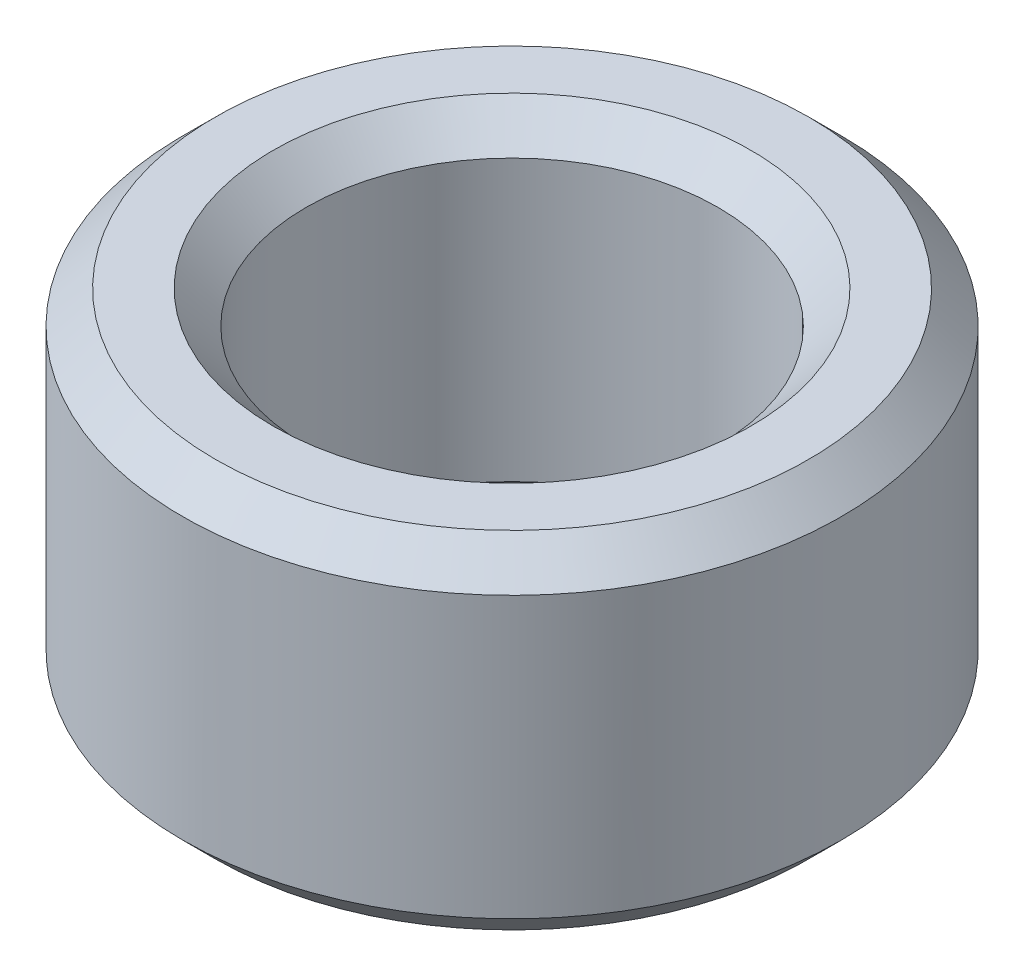
from build123d import *

# Parameters (mm, degrees)
SKETCH1_R           = 2
SKETCH1_R_2         = 1.25
BOSS_EXTRUDE1_DEPTH = 2.1
CHAMFER1_SIZE       = 0.2


with BuildPart() as part:
    # Sketch1 → Boss-Extrude1 (new body)
    with BuildSketch(Plane(origin=(0, 0, 0), x_dir=(1, 0, 0), z_dir=(0, 1, 0))):
        Circle(SKETCH1_R)
        Circle(SKETCH1_R_2, mode=Mode.SUBTRACT)
    extrude(amount=BOSS_EXTRUDE1_DEPTH)

    # Chamfer1
    chamfer1_edges = [part.edges().sort_by_distance(p)[0] for p in [
        (-1.25, 0, 0),
        (-1.25, 2.1, 0),
        (-2, 0, 0),
        (-2, 2.1, 0),
    ]]
    chamfer(chamfer1_edges, length=CHAMFER1_SIZE)


solid = part.part
